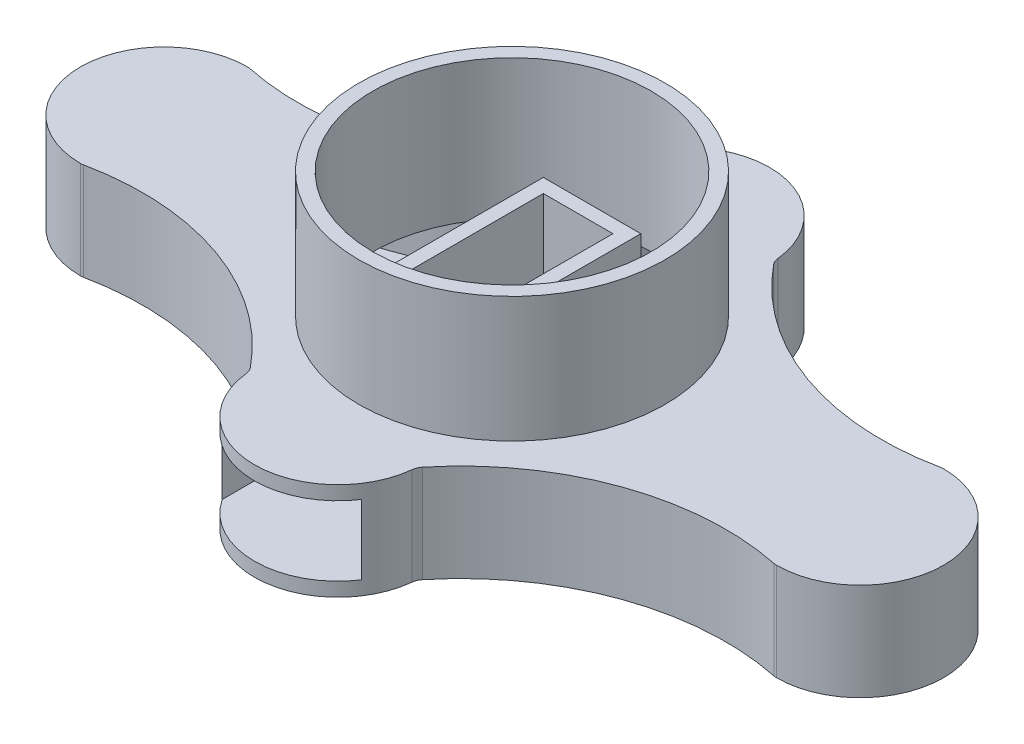
from build123d import *

# Parameters (mm, degrees)
BOSS_EXTRUDE6_DEPTH = 12.7
SKETCH10_R          = 25.4
BOSS_EXTRUDE7_DEPTH = 25.4
SHELL14_T           = 2.5399999999999943
FILLET1_R           = 2.54
BOSS_EXTRUDE8_DEPTH = 25.4
SKETCH12_W          = 12.7
SKETCH12_H          = 2.5399999999999974
CUT_EXTRUDE6_DEPTH  = 25.4
CUT_EXTRUDE7_REACH  = 108.984
SKETCH15_W          = 25.4
SKETCH15_H          = 12.699999999999998


with BuildPart() as part:
    # Sketch9 → Boss-Extrude6 (new body)
    with BuildSketch(Plane(origin=(0, 0, 0), x_dir=(1, 0, 0), z_dir=(0, 1, 0))):
        with BuildLine():
            ThreePointArc((-63.5, 12.699999999999985), (-76.2, -1.232e-14), (-63.5, -12.700000000000014))
            ThreePointArc((-63.5, -12.700000000000014), (-35.34389302544592, -14.875381401189138), (-12.7, -31.75))
            ThreePointArc((-12.7, -31.75), (1.154e-14, -44.45000000000002), (12.7, -31.75))
            ThreePointArc((12.7, -31.75), (35.34389302544593, -14.875381401189138), (63.5, -12.700000000000001))
            ThreePointArc((63.5, -12.700000000000001), (76.2, 1.68e-15), (63.5, 12.700000000000001))
            ThreePointArc((63.5, 12.700000000000001), (35.34389302544591, 14.87538140118913), (12.7, 31.75))
            ThreePointArc((12.7, 31.75), (4.06e-15, 44.44999999999999), (-12.7, 31.75))
            ThreePointArc((-12.7, 31.75), (-35.34389302544592, 14.87538140118913), (-63.5, 12.699999999999985))
        make_face()
    extrude(amount=BOSS_EXTRUDE6_DEPTH)

    # Sketch10 → Boss-Extrude7 (add)
    with BuildSketch(Plane(origin=(0, 12.7, 0), x_dir=(1, 0, 0), z_dir=(0, 1, 0))):
        with Locations(Location((0, 0, 0), (0, 0, 270))):
            Circle(SKETCH10_R)
    extrude(amount=BOSS_EXTRUDE7_DEPTH)

    # Shell14
    shell14_openings = [part.faces().sort_by_distance(p)[0] for p in [
        (0, 38.1, 0),
    ]]
    offset(amount=SHELL14_T, openings=shell14_openings, kind=Kind.INTERSECTION)

    # Fillet1
    # the kernel refuses this fillet: 2.54 mm, written as the material it adds along each edge
    with BuildSketch(Plane(origin=(15.213395442859193, 15.239999999999993, 32.65011060386543), x_dir=(-0.08244746024425967, 0, 0.9965954125417552), z_dir=(0, -1, 0))) as fillet1_piece_1:
        with BuildLine():
            CenterArc((0.7740627209529523, -2.5393019901274583), FILLET1_R, 91.3432643866729, 32.987937528232266)
            ThreePointArc((-0.6584359095530802, -0.44179211563381704), (-0.33012530713560906, -0.2195437625751302), (0, 0))
            ThreePointArc((0, 0), (0.357259717362898, -0.00418805923524796), (0.7145194347258012, 0))
        make_face()
    extrude(amount=17.779999999999987)
    with BuildSketch(Plane(origin=(-15.213395442859223, 15.239999999999993, 32.65011060386536), x_dir=(-0.623740024012636, 0, -0.7816318714361103), z_dir=(0, -1, 0))) as fillet1_piece_2:
        with BuildLine():
            CenterArc((0.7720512245924565, -2.5399142898215286), FILLET1_R, 89.52930650878288, 32.98793752823278)
            ThreePointArc((-0.5933344507841877, -0.3981108540515074), (-0.2943337523500303, -0.20253317683271896), (0, 0))
            ThreePointArc((0, 0), (0.396458736952872, 0.00162849339096533), (0.7929174739057625, 3e-17))
        make_face()
    extrude(amount=17.779999999999987)
    with BuildSketch(Plane(origin=(-15.213395442859191, 15.239999999999993, -32.6501106038654), x_dir=(-0.6237400240126415, 0, 0.781631871436106), z_dir=(0, -1, 0))) as fillet1_piece_3:
        with BuildLine():
            CenterArc((0.7720512245925322, 2.5399142898215272), FILLET1_R, 237.48275596298424, 32.987937528232294)
            ThreePointArc((-0.593334450784115, 0.3981108540515081), (-0.2943337523499901, 0.20253317683272415), (0, 0))
            ThreePointArc((0, 0), (0.3964587369529053, -0.00162849339097196), (0.7929174739058125, 2e-17))
        make_face()
    extrude(amount=17.779999999999987)
    with BuildSketch(Plane(origin=(15.21339544285919, 15.239999999999993, -32.65011060386541), x_dir=(-0.08244746024426708, 0, -0.9965954125417545), z_dir=(0, -1, 0))) as fillet1_piece_4:
        with BuildLine():
            CenterArc((0.7740627209529621, 2.539301990127459), FILLET1_R, 235.66879808509486, 32.987937528232465)
            ThreePointArc((-0.6584359095530695, 0.44179211563381504), (-0.330125307135611, 0.21954376257513125), (0, 0))
            ThreePointArc((0, 0), (0.3572597173629123, 0.00418805923525002), (0.714519434725823, 0))
        make_face()
    extrude(amount=17.779999999999987)
    # the kernel refuses this fillet: 2.54 mm, written as the material it takes off along each edge
    with BuildSketch(Plane(origin=(63.22420496202578, 15.929515824336315, 15.23750429358524), x_dir=(-0.9786320251398054, 0, -0.2056194528024121), z_dir=(0, -1, 0))) as fillet1_2_piece_1:
        with BuildLine():
            CenterArc((0.25185838779454184, 2.5399917904261593), FILLET1_R, 258.13423637706234, 11.720089907990712)
            ThreePointArc((-0.2704150223235917, 0.05426644657105567), (-0.13533027474319617, 0.02652148032641584), (0, 0))
            ThreePointArc((0, 0), (0.12270024020757794, 0.00015598190298779), (0.2454004804151519, 0))
        make_face()
    extrude(amount=19.15903164867263, mode=Mode.SUBTRACT)
    with BuildSketch(Plane(origin=(-63.22420496202586, 15.929515824336706, 15.237504293585257), x_dir=(-0.9999590590960623, 0, 0.009048764098899606), z_dir=(0, -1, 0))) as fillet1_2_piece_2:
        with BuildLine():
            CenterArc((0.2528224689234374, 2.5398960101039973), FILLET1_R, 258.79837316015426, 11.720089907990541)
            ThreePointArc((-0.24060352948943128, 0.04828392470822683), (-0.12027107442804234, 0.02429489521037388), (0, 0))
            ThreePointArc((0, 0), (0.1379031648673247, -0.00062393937600912), (0.27580632973464947, 0))
        make_face()
    extrude(amount=19.159031648673412, mode=Mode.SUBTRACT)
    with BuildSketch(Plane(origin=(-63.22420496202585, 15.92951582433667, -15.237504293585229), x_dir=(-0.9999590590960623, 0, -0.00904876409889914), z_dir=(0, -1, 0))) as fillet1_2_piece_3:
        with BuildLine():
            CenterArc((0.2528224689234528, -2.5398960101039973), FILLET1_R, 89.48153693185522, 11.720089907991053)
            ThreePointArc((-0.2406035294894384, -0.04828392470823043), (-0.12027107442802101, -0.02429489521037413), (0, 0))
            ThreePointArc((0, 0), (0.1379031648673247, 0.00062393937600918), (0.2758063297346637, 0))
        make_face()
    extrude(amount=19.15903164867334, mode=Mode.SUBTRACT)
    with BuildSketch(Plane(origin=(63.22420496202587, 15.929515824336635, -15.237504293585246), x_dir=(0.9999590590960625, 0, -0.00904876409889984), z_dir=(0, -1, 0))) as fillet1_2_piece_4:
        with BuildLine():
            CenterArc((0.25282246892342264, 2.539896010103998), FILLET1_R, 258.79837316015426, 11.720089907990712)
            ThreePointArc((-0.24060352948944552, 0.04828392470822666), (-0.12027107442801392, 0.02429489521037056), (0, 0))
            ThreePointArc((0, 0), (0.13790316486732473, -0.00062393937600909), (0.2758063297346424, 0))
        make_face()
    extrude(amount=19.15903164867327, mode=Mode.SUBTRACT)

    # Sketch11 → Boss-Extrude8 (add)
    with BuildSketch(Plane(origin=(0, 0, 0), x_dir=(1, 0, 0), z_dir=(0, 1, 0))):
        Polygon((8.889999999999997, 14.605), (8.890000000000002, -14.605), (-8.889999999999999, -14.604999999999997), (-8.890000000000002, 14.605), align=None)
        Polygon((-6.350000000000001, 12.065), (6.349999999999998, 12.065), (6.3500000000000005, -12.065), (-6.349999999999999, -12.065), align=None, mode=Mode.SUBTRACT)
    extrude(amount=BOSS_EXTRUDE8_DEPTH)

    # Sketch12 → Cut-Extrude6 (cut)
    with BuildSketch(Plane(origin=(0, 25.4, 0), x_dir=(1, 0, 0), z_dir=(0, 1, 0))):
        with Locations((8.9e-16, -13.334999999999997)):
            Rectangle(SKETCH12_W, SKETCH12_H)
    extrude(amount=-CUT_EXTRUDE6_DEPTH, mode=Mode.SUBTRACT)

    # Sketch15 → Cut-Extrude7 (cut, up to next)
    with BuildSketch(Plane.XY.offset(14.604999999999999), mode=Mode.PRIVATE) as cut_extrude7_sk1:
        with Locations((1.865e-14, 6.349999999999999)):
            Rectangle(SKETCH15_W, SKETCH15_H)
    cut_extrude7_tool1 = extrude(cut_extrude7_sk1.sketch, amount=CUT_EXTRUDE7_REACH, mode=Mode.PRIVATE) & part.part
    add(cut_extrude7_tool1.solids().sort_by_distance((0, 6.35, 14.605))[0], mode=Mode.SUBTRACT)


solid = part.part
